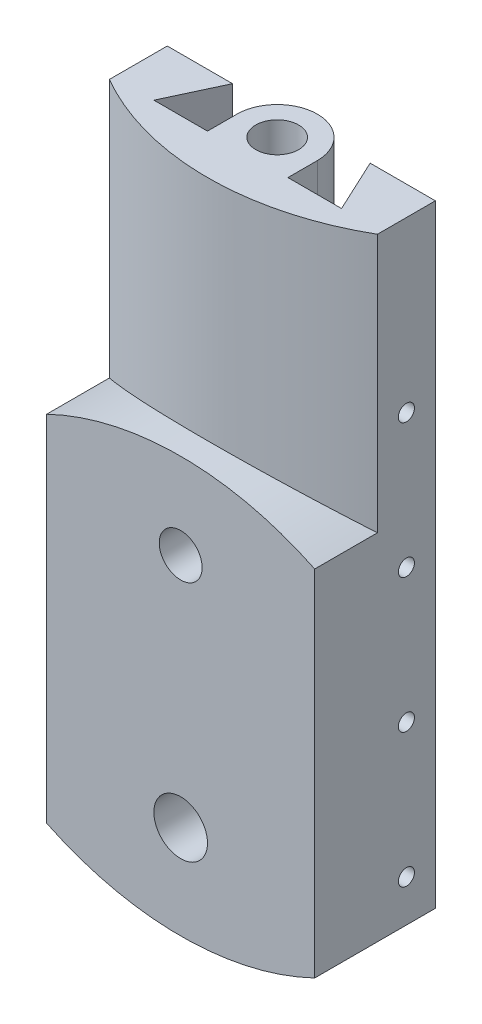
from build123d import *

# Parameters (mm, degrees)
SKETCH1_R           = 8
BOSS_EXTRUDE1_DEPTH = 25
BOSS_EXTRUDE2_DEPTH = 240
BOSS_EXTRUDE3_REACH = 252.402
SKETCH3_R           = 8
SKETCH3_R_2         = 10
CUT_EXTRUDE1_DEPTH  = 251.401677426
SKETCH4_R           = 3
CUT_EXTRUDE2_DEPTH  = 265.954713149


with BuildPart() as part:
    # Sketch1 → Boss-Extrude1 (new body)
    with BuildSketch(Plane(origin=(0, 0, 0), x_dir=(1, 0, 0), z_dir=(0, 1, 0))):
        with BuildLine():
            Line((-15, 36), (-15, 25))
            Line((-15, 25), (-15, 23.5))
            Line((-15, 23.5), (15, 23.5))
            Line((15, 23.5), (15, 25))
            Line((15, 25), (15, 36))
            ThreePointArc((15, 36), (0, 51), (-15, 36))
        make_face()
        with Locations((0, 36)):
            Circle(SKETCH1_R, mode=Mode.SUBTRACT)
    extrude(amount=-BOSS_EXTRUDE1_DEPTH)

    # Sketch1<3> → Boss-Extrude2 (add)
    with BuildSketch(Plane(origin=(0, 0, 0), x_dir=(1, 0, 0), z_dir=(0, 1, 0))):
        with BuildLine():
            Line((-50, 45), (-50, 23.397459622))
            ThreePointArc((-50, 23.397459622), (0, 10), (50, 23.397459622))
            Line((50, 23.397459622), (50, 45))
            Line((50, 45), (25.673846837, 45))
            Line((25.673846837, 45), (35, 25))
            Line((35, 25), (15, 25))
            Line((15, 25), (15, 23.5))
            Line((15, 23.5), (-15, 23.5))
            Line((-15, 23.5), (-15, 25))
            Line((-15, 25), (-35, 25))
            Line((-35, 25), (-25.673846837, 45))
            Line((-25.673846837, 45), (-50, 45))
        make_face()
    extrude(amount=-BOSS_EXTRUDE2_DEPTH)

    # Sketch2 → Boss-Extrude3 (add, up to next)
    with BuildSketch(Plane.XY, mode=Mode.PRIVATE) as boss_extrude3_sk1:
        with BuildLine():
            Line((50, -96.438424114), (50, -228.561575886))
            ThreePointArc((50, -228.561575886), (0, -240), (-50, -228.561575886))
            Line((-50, -228.561575886), (-50, -96.438424114))
            ThreePointArc((-50, -96.438424114), (0, -85), (50, -96.438424114))
        make_face()
    boss_extrude3_tool1 = extrude(boss_extrude3_sk1.sketch, amount=-BOSS_EXTRUDE3_REACH, mode=Mode.PRIVATE) - part.part
    add(boss_extrude3_tool1.solids().sort_by_distance((0, -162.5, 0))[0])

    # Sketch3 → Cut-Extrude1 (cut, through all)
    with BuildSketch(Plane.XY):
        with BuildLine():
            ThreePointArc((0, -240), (-25.645845405, -237.103927734), (-50, -228.561575886))
            Line((-50, -228.561575886), (-50, -240))
            Line((-50, -240), (0, -240))
        make_face()
        with BuildLine():
            ThreePointArc((50, -228.561575886), (25.645845405, -237.103927734), (0, -240))
            Line((0, -240), (50, -240))
            Line((50, -240), (50, -228.561575886))
        make_face()
        with Locations((0, -117)):
            Circle(SKETCH3_R)
        with Locations((0, -205)):
            Circle(SKETCH3_R_2)
    extrude(amount=-CUT_EXTRUDE1_DEPTH, mode=Mode.SUBTRACT)

    # Sketch4 → Cut-Extrude2 (cut, through all)
    with BuildSketch(Plane(origin=(50, 0, 0), x_dir=(0, 0, -1), z_dir=(1, 0, 0))):
        with Locations((34.198729811, -63)):
            Circle(SKETCH4_R)
        with Locations((34.198729811, -113)):
            Circle(SKETCH4_R)
        with Locations((34.198729811, -163)):
            Circle(SKETCH4_R)
        with Locations((34.198729811, -213)):
            Circle(SKETCH4_R)
    extrude(amount=-CUT_EXTRUDE2_DEPTH, mode=Mode.SUBTRACT)


solid = part.part
